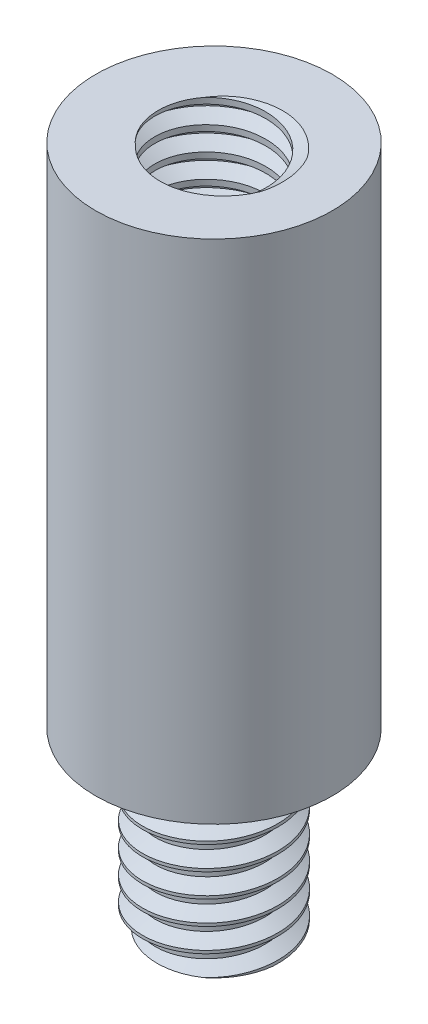
from build123d import *

# Parameters (mm, degrees)
SKETCH1_R           = 3.5
BOSS_EXTRUDE1_DEPTH = 7.5
SKETCH2_R           = 1.65
CUT_EXTRUDE1_DEPTH  = 6.5
THREAD1_PITCH       = 0.7
SKETCH3_R           = 2
BOSS_EXTRUDE2_DEPTH = 5
THREAD3_PITCH       = 0.7


with BuildPart() as part:
    # Sketch1 → Boss-Extrude1 (new, symmetric)
    with BuildSketch(Plane(origin=(0, 0, 0), x_dir=(1, 0, 0), z_dir=(0, 1, 0))):
        with Locations(Location((0, 0, 0), (0, 0, 270))):
            Circle(SKETCH1_R)
    extrude(amount=BOSS_EXTRUDE1_DEPTH, both=True)

    # Sketch2 → Cut-Extrude1 (cut)
    with BuildSketch(Plane(origin=(0, 7.5, 0), x_dir=(1, 0, 0), z_dir=(0, 1, 0))):
        with Locations(Location((0, 0, 0), (0, 0, 270))):
            Circle(SKETCH2_R)
    extrude(amount=-CUT_EXTRUDE1_DEPTH, mode=Mode.SUBTRACT)

    # Thread1: the profile of Thread Profile1 profile screwed along a right-hand helix of 11.428571 turns, 6 arcs to a turn; built about Z, then put on its axis
    thread1_z = Axis((0, 0, 0), (0, 0, 1))
    thread1_corners = [(1.6497, 0, -0.000173205), (2.028886112, 0, 0.218749999), (2.028886112, 0, 0.306249999), (1.6497, 0, 0.525173203)]
    with BuildLine(mode=Mode.PRIVATE) as thread1_profile:
        Line(thread1_corners[0], thread1_corners[1])
        Line(thread1_corners[1], thread1_corners[2])
        Line(thread1_corners[2], thread1_corners[3])
        Line(thread1_corners[3], thread1_corners[0])
    thread1_cap = Face(thread1_profile.wire())
    thread1_turn_angles = [0, 30, 60, 90, 120, 150, 180, 210, 240, 270, 300, 330, 360]
    thread1_turn_weights = [1, 0.8660254037844387, 1, 0.8660254037844387, 1, 0.8660254037844387, 1, 0.8660254037844387, 1, 0.8660254037844387, 1, 0.8660254037844387, 1]
    thread1_turn_rails = [Edge.make_bspline([Vector(p[0], p[1], 0).rotate(thread1_z, thread1_turn_angles[k]) / thread1_turn_weights[k] + Vector(0, 0, p[2] + THREAD1_PITCH * thread1_turn_angles[k] / 360) for k in range(13)], [0, 0, 0, 1, 1, 2, 2, 3, 3, 4, 4, 5, 5, 6, 6, 6], 2, thread1_turn_weights) for p in thread1_corners]
    thread1_turn_sides = [Face.make_surface_from_curves(thread1_turn_rails[p[0]], thread1_turn_rails[p[1]]) for p in [(0, 1), (1, 2), (2, 3), (3, 0)]]
    thread1_last_angles = [3960, 3990, 4020, 4050, 4080, 4097.142857143, 4114.285714286]
    thread1_last_weights = [1, 0.8660254037844387, 1, 0.8660254037844387, 1, 0.9555728057861397, 1]
    thread1_last_rails = [Edge.make_bspline([Vector(p[0], p[1], 0).rotate(thread1_z, thread1_last_angles[k]) / thread1_last_weights[k] + Vector(0, 0, p[2] + THREAD1_PITCH * thread1_last_angles[k] / 360) for k in range(7)], [0, 0, 0, 1, 1, 2, 2, 3, 3, 3], 2, thread1_last_weights) for p in thread1_corners]
    thread1_last_sides = [Face.make_surface_from_curves(thread1_last_rails[p[0]], thread1_last_rails[p[1]]) for p in [(0, 1), (1, 2), (2, 3), (3, 0)]]
    thread1 = Plane(origin=(0, 9.5, 0), x_dir=(-1, 0, 0), z_dir=(0, -1, 0)) * Solid(Shell([*[p.moved(Location((0, 0, THREAD1_PITCH * i))) for i in range(11) for p in thread1_turn_sides], *thread1_last_sides, thread1_cap, thread1_cap.rotate(thread1_z, 4114.285714286).moved(Location((0, 0, THREAD1_PITCH * 4114.285714286 / 360)))]))
    add(thread1, mode=Mode.SUBTRACT)

    # Sketch3 → Boss-Extrude2 (add)
    with BuildSketch(Plane.XZ.offset(7.5)):
        with Locations(Location((0, 0, 0), (0, 0, 270))):
            Circle(SKETCH3_R)
    extrude(amount=BOSS_EXTRUDE2_DEPTH)

    # Thread3: the profile of Thread Profile3 profile screwed along a right-hand helix of 10 turns, 6 arcs to a turn; built about Z, then put on its axis
    thread3_z = Axis((0, 0, 0), (0, 0, 1))
    thread3_corners = [(2.0003, 0, -0.000173205), (2.0003, 0, 0.612673203), (1.621113887, 0, 0.393749999), (1.621113887, 0, 0.218749999)]
    with BuildLine(mode=Mode.PRIVATE) as thread3_profile:
        Line(thread3_corners[0], thread3_corners[1])
        Line(thread3_corners[1], thread3_corners[2])
        Line(thread3_corners[2], thread3_corners[3])
        Line(thread3_corners[3], thread3_corners[0])
    thread3_cap = Face(thread3_profile.wire())
    thread3_turn_angles = [0, 30, 60, 90, 120, 150, 180, 210, 240, 270, 300, 330, 360]
    thread3_turn_weights = [1, 0.8660254037844387, 1, 0.8660254037844387, 1, 0.8660254037844387, 1, 0.8660254037844387, 1, 0.8660254037844387, 1, 0.8660254037844387, 1]
    thread3_turn_rails = [Edge.make_bspline([Vector(p[0], p[1], 0).rotate(thread3_z, thread3_turn_angles[k]) / thread3_turn_weights[k] + Vector(0, 0, p[2] + THREAD3_PITCH * thread3_turn_angles[k] / 360) for k in range(13)], [0, 0, 0, 1, 1, 2, 2, 3, 3, 4, 4, 5, 5, 6, 6, 6], 2, thread3_turn_weights) for p in thread3_corners]
    thread3_turn_sides = [Face.make_surface_from_curves(thread3_turn_rails[p[0]], thread3_turn_rails[p[1]]) for p in [(0, 1), (1, 2), (2, 3), (3, 0)]]
    thread3 = Plane(origin=(0, -14.5, 0), x_dir=(1, 0, 0), z_dir=(0, 1, 0)) * Solid(Shell([*[p.moved(Location((0, 0, THREAD3_PITCH * i))) for i in range(10) for p in thread3_turn_sides], thread3_cap, thread3_cap.rotate(thread3_z, 3600).moved(Location((0, 0, THREAD3_PITCH * 3600 / 360)))]))
    add(thread3, mode=Mode.SUBTRACT)


solid = part.part
